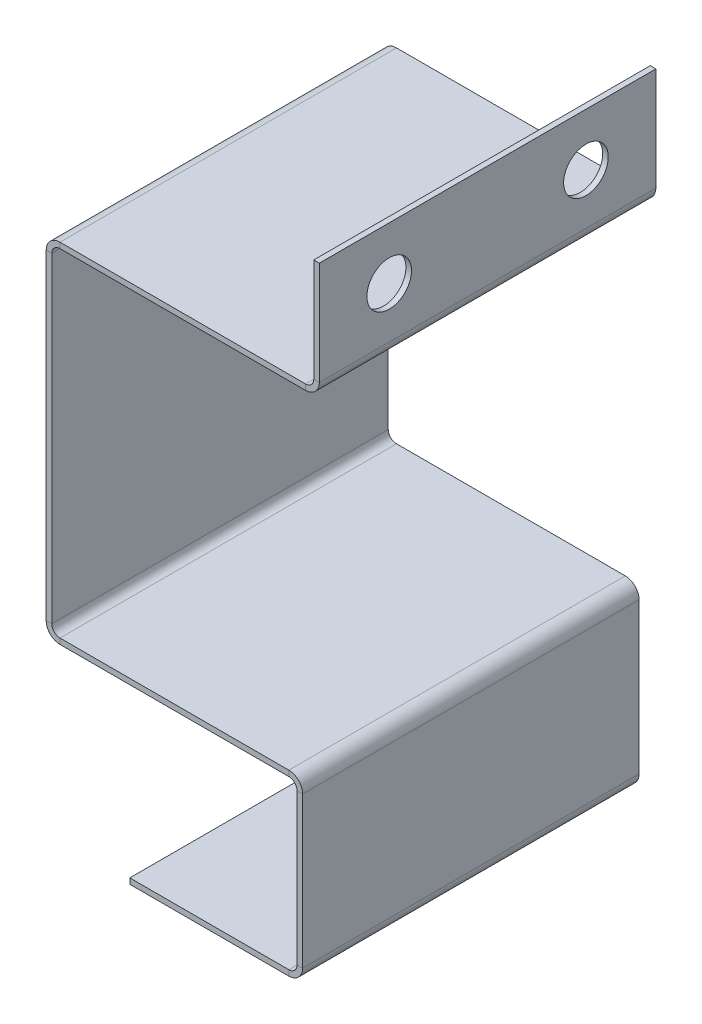
from build123d import *

# Parameters (mm, degrees)
SKETCH1_W                    = 15
SKETCH1_H                    = 30.181487224
BASE_FLANGE2_DEPTH           = 0.5
EDGE_FLANGE1_STRIP_W         = 3.4732
EDGE_FLANGE1_STRIP_H         = 0.5
EDGE_FLANGE1_STRIP_CUT_DEPTH = 30.181487223
EDGE_FLANGE1_DEPTH           = 30.181487223
EDGE_FLANGE2_STRIP_W         = 3.4732
EDGE_FLANGE2_STRIP_H         = 0.5
EDGE_FLANGE2_STRIP_CUT_DEPTH = 30.181487223
EDGE_FLANGE2_DEPTH           = 30.181487223
EDGE_FLANGE6_STRIP_W         = 3.4732
EDGE_FLANGE6_STRIP_H         = 0.5
EDGE_FLANGE6_STRIP_CUT_DEPTH = 30.181487223
EDGE_FLANGE6_DEPTH           = 30.181487223
EDGE_FLANGE7_STRIP_W         = 3.4732
EDGE_FLANGE7_STRIP_H         = 0.5
EDGE_FLANGE7_STRIP_CUT_DEPTH = 30.181487223
EDGE_FLANGE7_DEPTH           = 30.181487223
EDGE_FLANGE8_STRIP_W         = 3.4732
EDGE_FLANGE8_STRIP_H         = 0.5
EDGE_FLANGE8_STRIP_CUT_DEPTH = 30.181487223
EDGE_FLANGE8_DEPTH           = 30.181487223
SKETCH58_R                   = 2
CUT_EXTRUDE1_DEPTH           = 64.437315854


# Sheet-metal steps are written as plain solids
with BuildPart() as part:
    # Sketch1 → Base-Flange2 (new body)
    with BuildSketch(Plane(origin=(0, 0, 0), x_dir=(1, 0, 0), z_dir=(0, 1, 0))):
        Rectangle(SKETCH1_W, SKETCH1_H)
    extrude(amount=BASE_FLANGE2_DEPTH)

    # Edge-Flange1 strip (across the edge) → Edge-Flange1 strip cut (cut)
    with BuildSketch(Plane(origin=(7.5, 0.5, 15.090743612), x_dir=(-1, 0, 0), z_dir=(0, 0, -1))):
        with Locations((-1, -0.25)):
            Rectangle(EDGE_FLANGE1_STRIP_W, EDGE_FLANGE1_STRIP_H)
    extrude(amount=EDGE_FLANGE1_STRIP_CUT_DEPTH, mode=Mode.SUBTRACT)

    # Edge-Flange1 section (across the edge) → Edge-Flange1 (add)
    with BuildSketch(Plane(origin=(7.5, 0.5, 15.090743612), x_dir=(-1, 0, 0), z_dir=(0, 0, -1))):
        with BuildLine():
            Line((-0.5, 0.7366), (-0.5, 15))
            Line((-0.5, 15), (0, 15))
            Line((0, 15), (0, 0.7366))
            ThreePointArc((0, 0.7366), (0.215745145, 0.215745145), (0.7366, 0))
            Line((0.7366, 0), (0.7366, -0.5))
            ThreePointArc((0.7366, -0.5), (-0.137808246, -0.137808246), (-0.5, 0.7366))
        make_face()
    extrude(amount=EDGE_FLANGE1_DEPTH)

    # Edge-Flange2 strip (across the edge) → Edge-Flange2 strip cut (cut)
    with BuildSketch(Plane(origin=(7.5, 15.5, 15.090743612), x_dir=(0, -1, 0), z_dir=(0, 0, -1))):
        with Locations((-1, -0.25)):
            Rectangle(EDGE_FLANGE2_STRIP_W, EDGE_FLANGE2_STRIP_H)
    extrude(amount=EDGE_FLANGE2_STRIP_CUT_DEPTH, mode=Mode.SUBTRACT)

    # Edge-Flange2 section (across the edge) → Edge-Flange2 (add)
    with BuildSketch(Plane(origin=(7.5, 15.5, 15.090743612), x_dir=(0, -1, 0), z_dir=(0, 0, -1))):
        with BuildLine():
            Line((-0.5, 0.7366), (-0.5, 22))
            Line((-0.5, 22), (0, 22))
            Line((0, 22), (0, 0.7366))
            ThreePointArc((0, 0.7366), (0.215745145, 0.215745145), (0.7366, 0))
            Line((0.7366, 0), (0.7366, -0.5))
            ThreePointArc((0.7366, -0.5), (-0.137808246, -0.137808246), (-0.5, 0.7366))
        make_face()
    extrude(amount=EDGE_FLANGE2_DEPTH)

    # Edge-Flange6 strip (across the edge) → Edge-Flange6 strip cut (cut)
    with BuildSketch(Plane(origin=(-14.5, 16, -15.090743612), x_dir=(1, 0, 0), z_dir=(0, 0, 1))):
        with Locations((-1, -0.25)):
            Rectangle(EDGE_FLANGE6_STRIP_W, EDGE_FLANGE6_STRIP_H)
    extrude(amount=EDGE_FLANGE6_STRIP_CUT_DEPTH, mode=Mode.SUBTRACT)

    # Edge-Flange6 section (across the edge) → Edge-Flange6 (add)
    with BuildSketch(Plane(origin=(-14.5, 16, -15.090743612), x_dir=(1, 0, 0), z_dir=(0, 0, 1))):
        with BuildLine():
            Line((-0.5, 0.7366), (-0.5, 30.25))
            Line((-0.5, 30.25), (0, 30.25))
            Line((0, 30.25), (0, 0.7366))
            ThreePointArc((0, 0.7366), (0.215745145, 0.215745145), (0.7366, 0))
            Line((0.7366, 0), (0.7366, -0.5))
            ThreePointArc((0.7366, -0.5), (-0.137808246, -0.137808246), (-0.5, 0.7366))
        make_face()
    extrude(amount=EDGE_FLANGE6_DEPTH)

    # Edge-Flange7 strip (across the edge) → Edge-Flange7 strip cut (cut)
    with BuildSketch(Plane(origin=(-14.5, 46.25, -15.090743612), x_dir=(0, -1, 0), z_dir=(0, 0, 1))):
        with Locations((-1, -0.25)):
            Rectangle(EDGE_FLANGE7_STRIP_W, EDGE_FLANGE7_STRIP_H)
    extrude(amount=EDGE_FLANGE7_STRIP_CUT_DEPTH, mode=Mode.SUBTRACT)

    # Edge-Flange7 section (across the edge) → Edge-Flange7 (add)
    with BuildSketch(Plane(origin=(-14.5, 46.25, -15.090743612), x_dir=(0, -1, 0), z_dir=(0, 0, 1))):
        with BuildLine():
            Line((-0.5, 0.7366), (-0.5, 23.5))
            Line((-0.5, 23.5), (0, 23.5))
            Line((0, 23.5), (0, 0.7366))
            ThreePointArc((0, 0.7366), (0.215745145, 0.215745145), (0.7366, 0))
            Line((0.7366, 0), (0.7366, -0.5))
            ThreePointArc((0.7366, -0.5), (-0.137808246, -0.137808246), (-0.5, 0.7366))
        make_face()
    extrude(amount=EDGE_FLANGE7_DEPTH)

    # Edge-Flange8 strip (across the edge) → Edge-Flange8 strip cut (cut)
    with BuildSketch(Plane(origin=(9, 46.75, 15.090743612), x_dir=(-1, 0, 0), z_dir=(0, 0, -1))):
        with Locations((-1, -0.25)):
            Rectangle(EDGE_FLANGE8_STRIP_W, EDGE_FLANGE8_STRIP_H)
    extrude(amount=EDGE_FLANGE8_STRIP_CUT_DEPTH, mode=Mode.SUBTRACT)

    # Edge-Flange8 section (across the edge) → Edge-Flange8 (add)
    with BuildSketch(Plane(origin=(9, 46.75, 15.090743612), x_dir=(-1, 0, 0), z_dir=(0, 0, -1))):
        with BuildLine():
            Line((-0.5, 0.7366), (-0.5, 10))
            Line((-0.5, 10), (0, 10))
            Line((0, 10), (0, 0.7366))
            ThreePointArc((0, 0.7366), (0.215745145, 0.215745145), (0.7366, 0))
            Line((0.7366, 0), (0.7366, -0.5))
            ThreePointArc((0.7366, -0.5), (-0.137808246, -0.137808246), (-0.5, 0.7366))
        make_face()
    extrude(amount=EDGE_FLANGE8_DEPTH)

    # Sketch58 → Cut-Extrude1 (cut, through all)
    with BuildSketch(Plane.ZY.offset(-9)):
        with Locations(Location((8.82216851, 52.036798661, 0), (0, 0, 270))):
            Circle(SKETCH58_R)
        with Locations(Location((-8.82216851, 52.036798661, 0), (0, 0, 90))):
            Circle(SKETCH58_R)
    extrude(amount=-CUT_EXTRUDE1_DEPTH, mode=Mode.SUBTRACT)


solid = part.part
